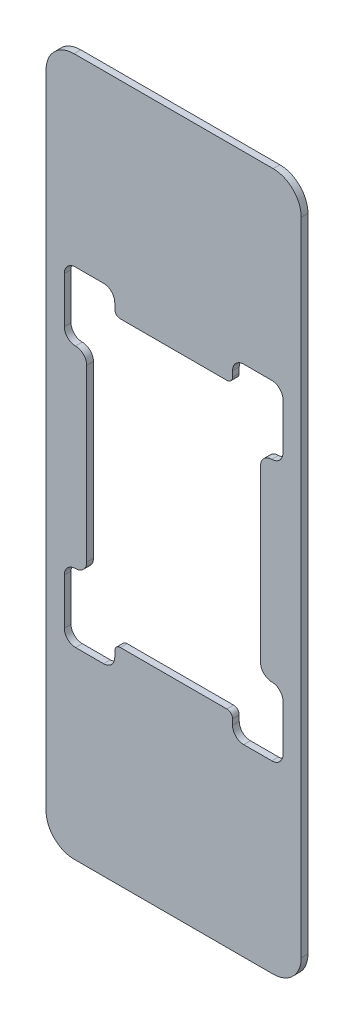
from build123d import *

# Parameters (mm, degrees)
SKETCH1_W           = 45.5
SKETCH1_H           = 124.4
BOSS_EXTRUDE1_DEPTH = 1.2
SKETCH2_W           = 5
SKETCH2_H           = 8.185483871
CUT_EXTRUDE1_DEPTH  = 1.6
FILLET1_R           = 2
FILLET2_R           = 1
FILLET3_R           = 5


with BuildPart() as part:
    # Sketch1 → Boss-Extrude1 (new body)
    with BuildSketch(Plane.XY):
        with Locations((22.75, 62.2)):
            Rectangle(SKETCH1_W, SKETCH1_H)
    extrude(amount=BOSS_EXTRUDE1_DEPTH)

    # Sketch2 → Cut-Extrude1 (cut)
    with BuildSketch(Plane.XY.offset(1.2)):
        Polygon((7.25, 87.575), (12.25, 87.575), (12.25, 91.575), (3.25, 91.575), (3.25, 79.389516129), (7.25, 79.389516129), align=None)
        with Locations((9.75, 83.482258065)):
            Rectangle(SKETCH2_W, SKETCH2_H)
        Polygon((33.25, 79.389516129), (33.25, 87.575), (12.25, 87.575), (12.25, 79.389516129), (7.25, 79.389516129), (7.25, 45.010483871), (12.25, 45.010483871), (12.25, 36.825), (33.25, 36.825), (33.25, 45.010483871), (38.25, 45.010483871), (38.25, 79.389516129), align=None)
        with Locations((35.75, 83.482258065)):
            Rectangle(SKETCH2_W, SKETCH2_H)
        Polygon((42.25, 79.389516129), (42.25, 91.575), (33.25, 91.575), (33.25, 87.575), (38.25, 87.575), (38.25, 79.389516129), align=None)
        Polygon((42.25, 45.010483871), (38.25, 45.010483871), (38.25, 36.825), (33.25, 36.825), (33.25, 32.825), (42.25, 32.825), align=None)
        with Locations((35.75, 40.917741936)):
            Rectangle(SKETCH2_W, SKETCH2_H)
        Polygon((7.25, 36.825), (7.25, 45.010483871), (3.25, 45.010483871), (3.25, 32.825), (12.25, 32.825), (12.25, 36.825), align=None)
        with Locations((9.75, 40.917741936)):
            Rectangle(SKETCH2_W, SKETCH2_H)
    extrude(amount=-CUT_EXTRUDE1_DEPTH, mode=Mode.SUBTRACT)

    # Fillet1
    fillet1_edges = [part.edges().sort_by_distance(p)[0] for p in [
        (3.25, 79.389516129, 0.6),
        (12.25, 91.575, 0.6),
        (33.25, 91.575, 0.6),
        (42.25, 91.575, 0.6),
        (42.25, 79.389516129, 0.6),
        (38.25, 79.389516129, 0.6),
        (38.25, 45.010483871, 0.6),
        (42.25, 45.010483871, 0.6),
        (42.25, 32.825, 0.6),
        (33.25, 32.825, 0.6),
        (12.25, 32.825, 0.6),
        (3.25, 32.825, 0.6),
        (3.25, 45.010483871, 0.6),
        (7.25, 45.010483871, 0.6),
        (7.25, 79.389516129, 0.6),
        (3.25, 91.575, 0.6),
    ]]
    fillet(fillet1_edges, radius=FILLET1_R - 0.0001)  # a hair under: the kernel refuses the full size

    # Fillet2
    fillet2_edges = [part.edges().sort_by_distance(p)[0] for p in [
        (12.25, 36.825, 0.6),
        (12.25, 87.575, 0.6),
        (33.25, 87.575, 0.6),
        (33.25, 36.825, 0.6),
    ]]
    fillet(fillet2_edges, radius=FILLET2_R)

    # Fillet3
    fillet3_edges = [part.edges().sort_by_distance(p)[0] for p in [
        (0, 124.4, 0.6),
        (45.5, 124.4, 0.6),
        (45.5, 0, 0.6),
        (0, 0, 0.6),
    ]]
    fillet(fillet3_edges, radius=FILLET3_R)


solid = part.part
